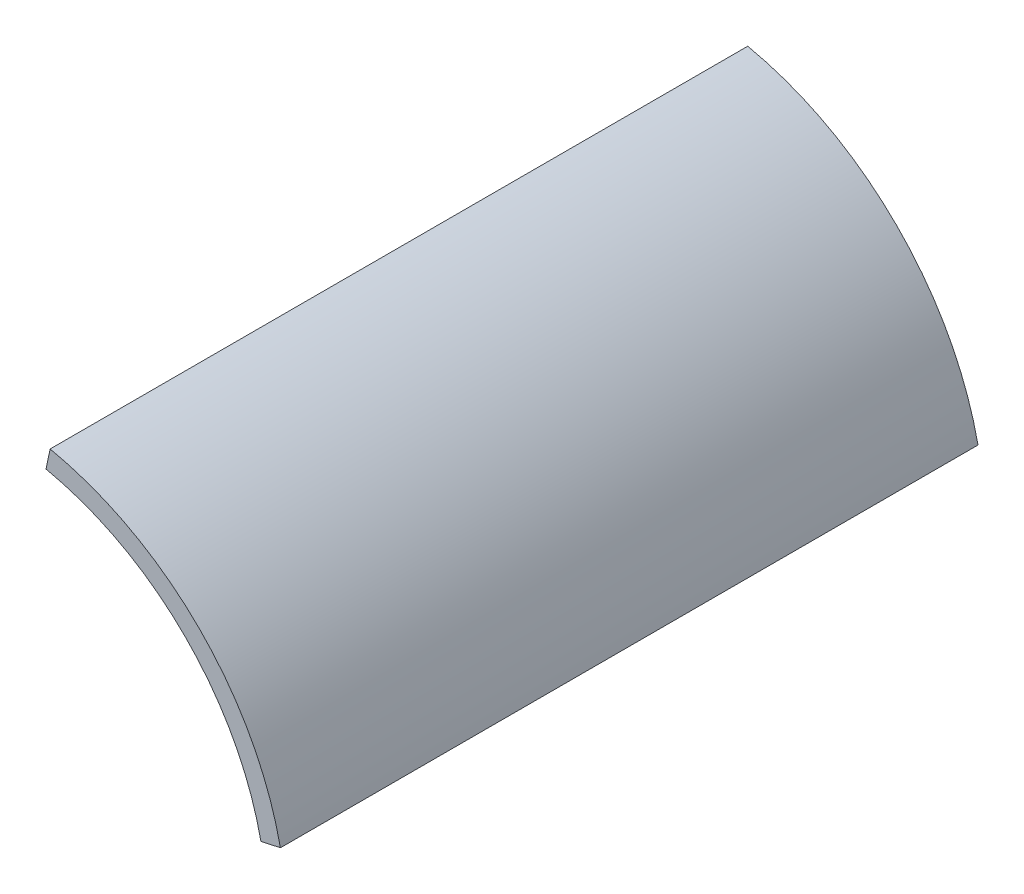
from build123d import *

# Parameters (mm, degrees)
SALIENTE_EXTRUIR1_DEPTH = 70


with BuildPart() as part:
    # Croquis1 → Saliente-Extruir1 (new body)
    with BuildSketch(Plane.XY):
        with BuildLine():
            Line((6.237350725, 29.344428022), (5.821527343, 27.388132821))
            ThreePointArc((5.821527343, 27.388132821), (19.798989873, 19.798989873), (27.388132821, 5.821527343))
            Line((27.388132821, 5.821527343), (29.344428022, 6.237350725))
            ThreePointArc((29.344428022, 6.237350725), (21.213203436, 21.213203436), (6.237350725, 29.344428022))
        make_face()
    extrude(amount=SALIENTE_EXTRUIR1_DEPTH)


solid = part.part
